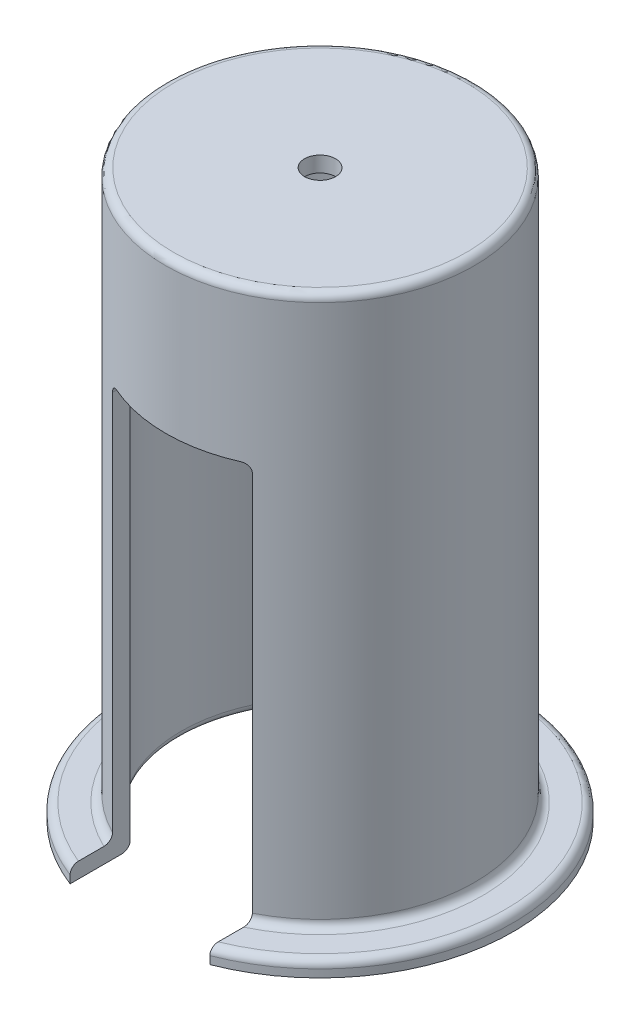
from build123d import *

# Parameters (mm, degrees)
SKETCH2_R           = 9.9375
BOSS_EXTRUDE1_DEPTH = 35.384
SKETCH3_R           = 8.9375
CUT_EXTRUDE1_DEPTH  = 34.384
SKETCH4_R           = 1
CUT_EXTRUDE2_DEPTH  = 39.072762817
SKETCH5_R           = 12.4375
BOSS_EXTRUDE2_DEPTH = 1
CUT_EXTRUDE3_REACH  = 42.413
SKETCH6_R           = 8.9375
CUT_EXTRUDE4_REACH  = 48.471
SKETCH7_W           = 9
SKETCH7_H           = 26.538
FILLET1_R           = 0.5


with BuildPart() as part:
    # Sketch2 → Boss-Extrude1 (new body)
    with BuildSketch(Plane(origin=(0, 0, 0), x_dir=(1, 0, 0), z_dir=(0, 1, 0))):
        Circle(SKETCH2_R)
    extrude(amount=BOSS_EXTRUDE1_DEPTH)

    # Sketch3 → Cut-Extrude1 (cut)
    with BuildSketch(Plane.XZ):
        Circle(SKETCH3_R)
    extrude(amount=-CUT_EXTRUDE1_DEPTH, mode=Mode.SUBTRACT)

    # Sketch4 → Cut-Extrude2 (cut, through all)
    with BuildSketch(Plane(origin=(0, 35.384, 0), x_dir=(1, 0, 0), z_dir=(0, 1, 0))):
        Circle(SKETCH4_R)
    extrude(amount=-CUT_EXTRUDE2_DEPTH, mode=Mode.SUBTRACT)

    # Sketch5 → Boss-Extrude2 (add)
    with BuildSketch(Plane.XZ):
        Circle(SKETCH5_R)
    extrude(amount=BOSS_EXTRUDE2_DEPTH)

    # Sketch6 → Cut-Extrude3 (cut, up to next)
    with BuildSketch(Plane.XZ.offset(1), mode=Mode.PRIVATE) as cut_extrude3_sk1:
        Circle(SKETCH6_R)
    cut_extrude3_tool1 = extrude(cut_extrude3_sk1.sketch, amount=-CUT_EXTRUDE3_REACH, mode=Mode.PRIVATE) & part.part
    add(cut_extrude3_tool1.solids().sort_by_distance((0, -1, 0))[0], mode=Mode.SUBTRACT)

    # Sketch7 → Cut-Extrude4 (cut, up to next)
    with BuildSketch(Plane.XY.offset(15), mode=Mode.PRIVATE) as cut_extrude4_sk1:
        with Locations((0, 12.269)):
            Rectangle(SKETCH7_W, SKETCH7_H)
    cut_extrude4_tool1 = extrude(cut_extrude4_sk1.sketch, amount=-CUT_EXTRUDE4_REACH, mode=Mode.PRIVATE) & part.part
    add(cut_extrude4_tool1.solids().sort_by_distance((0, 12.269, 15))[0], mode=Mode.SUBTRACT)

    # Fillet1
    fillet1_edges = [part.edges().sort_by_distance(p)[0] for p in [
        (-4.453097588, -1, -7.749117893),
        (0, 0, -12.4375),
        (-5.197843603, 0, -8.469730109),
        (-9.9375, 35.384, 0),
        (-8.9375, 34.384, 0),
        (4.5, 25.538, 8.291109277),
        (-4.5, 25.538, 8.291109277),
    ]]
    fillet(fillet1_edges, radius=FILLET1_R)


solid = part.part
